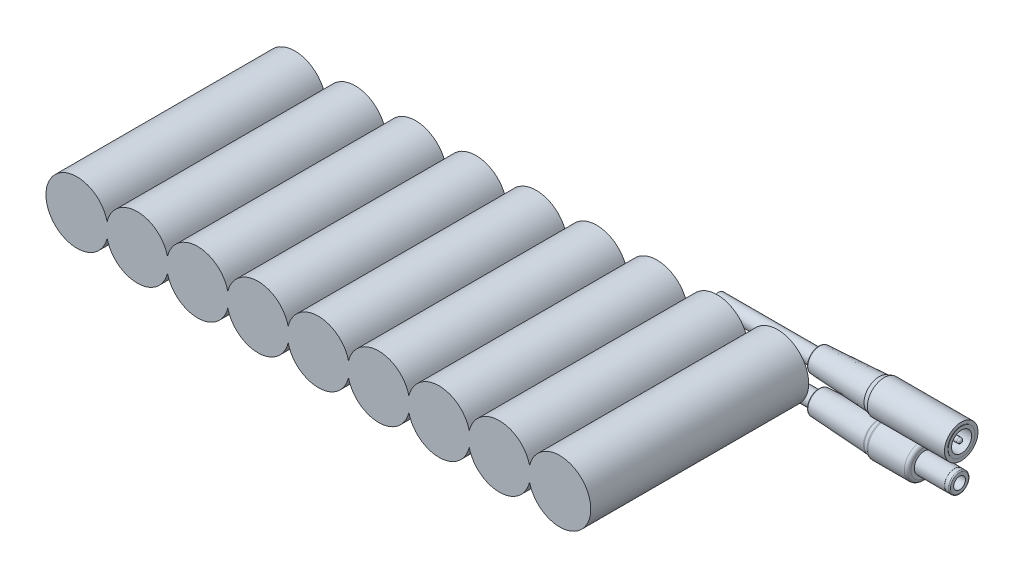
from build123d import *

# Parameters (mm, degrees)
SKETCH_1_R             = 9.25
EXTRUDE_1_DEPTH        = 65
PATTERN_LINEAR_1_COUNT = 9
PATTERN_LINEAR_1_PITCH = 18
SKETCH_4_R             = 2.25
EXTRUDE_2_DEPTH        = 30
EXTRUDE_2_2_DEPTH      = 30
SKETCH_9_R             = 3.5
SKETCH_10_R            = 4.5
SKETCH_11_R            = 5
SKETCH_14_R            = 4.5
SKETCH_12_R            = 5
SKETCH_13_R            = 4.5
SKETCH_17_R            = 5
EXTRUDE_3_DEPTH        = 23
SKETCH_18_R            = 5
EXTRUDE_4_DEPTH        = 12
SKETCH_19_R            = 3
EXTRUDE_5_DEPTH        = 9
SKETCH_20_R            = 2.98
EXTRUDE_6_DEPTH        = 1.5
SKETCH_21_R            = 4
EXTRUDE_7_DEPTH        = 0.1
SKETCH_22_R            = 3
SKETCH_22_R_2          = 0.75
CUT_EXTRUDE_1_DEPTH    = 10
FILLET_1_R             = 0.3
FILLET_2_R             = 0.7
FILLET_3_R             = 1
FILLET_4_R             = 1
FILLET_5_R             = 0.3
FILLET_6_R             = 0.3
SKETCH_23_R            = 1.75
CUT_EXTRUDE_2_DEPTH    = 5


with BuildPart() as part:
    # 草图1 → 凸台-拉伸1 (new body)
    with BuildSketch(Plane.XY):
        Circle(SKETCH_1_R)
    extrude_1 = extrude(amount=EXTRUDE_1_DEPTH)

    # 阵列(线性)1: 凸台-拉伸1 ×9
    with Locations(*[(-i * PATTERN_LINEAR_1_PITCH, 0, 0) for i in range(1, PATTERN_LINEAR_1_COUNT)]):
        add(extrude_1)


with BuildPart() as body_2:
    # 草图4 → 凸台-拉伸2 (new body)
    with BuildSketch(Plane(origin=(-20, 0, 0), x_dir=(0, 0, -1), z_dir=(1, 0, 0))):
        with Locations((2.25, -5.5)):
            Circle(SKETCH_4_R)
    extrude(amount=EXTRUDE_2_DEPTH)

    # 放样1: read off the stored shape, not the designer's step
    # 放样1: loft between two sections, ruled curve by curve
    loft_1_from = [
        Edge.make_bspline([(10, -6.265647347, 1.165228271), (10, -13.096103888, -0.366066424), (10, -11.564809194, -7.196522965), (10, -4.734352653, -5.665228271), (10, 2.096103888, -4.133933576), (10, 0.564809194, 2.696522965), (10, -6.265647347, 1.165228271)], [0, 0, 0, 0, 0.5, 0.5, 0.5, 1, 1, 1, 1], 3, [1, 0.333333333, 0.333333333, 1, 0.333333333, 0.333333333, 1]),
    ]
    loft_1_to = [
        Edge.make_bspline([(28, -7.36726301, 1.84430444), (28, -15.555871891, -1.89022158), (28, -11.821345871, -10.078830461), (28, -3.63273699, -6.34430444), (28, 4.555871891, -2.60977842), (28, 0.821345871, 5.578830461), (28, -7.36726301, 1.84430444)], [0, 0, 0, 0, 0.5, 0.5, 0.5, 1, 1, 1, 1], 3, [1, 0.333333333, 0.333333333, 1, 0.333333333, 0.333333333, 1]),
    ]
    loft_1 = Solid(Shell([*[Face.make_surface_from_curves(loft_1_from[k], loft_1_to[k]) for k in range(1)], Face(Wire(loft_1_from)), Face(Wire(loft_1_to))]))
    add(loft_1)

    # 草图11 → 放样3 section 0
    with BuildSketch(Plane(origin=(29.5, 0, 0), x_dir=(0, 0, -1), z_dir=(1, 0, 0))):
        with Locations((2.25, -5.5)):
            Circle(SKETCH_11_R)
    # 草图14 → 放样3 section 1
    with BuildSketch(Plane(origin=(28, 0, 0), x_dir=(0, 0, -1), z_dir=(1, 0, 0))):
        with Locations((2.25, -5.5)):
            Circle(SKETCH_14_R)
    loft()

    # 草图18 → 凸台-拉伸4 (add)
    with BuildSketch(Plane(origin=(29.5, 0, 0), x_dir=(0, 0, -1), z_dir=(1, 0, 0))):
        with Locations((2.25, -5.5)):
            Circle(SKETCH_18_R)
    extrude(amount=EXTRUDE_4_DEPTH)

    # 草图19 → 凸台-拉伸5 (add)
    with BuildSketch(Plane(origin=(41.5, 0, 0), x_dir=(0, 0, -1), z_dir=(1, 0, 0))):
        with Locations((2.25, -5.5)):
            Circle(SKETCH_19_R)
    extrude(amount=EXTRUDE_5_DEPTH)

    # 草图20 → 凸台-拉伸6 (add)
    with BuildSketch(Plane(origin=(50.5, 0, 0), x_dir=(0, 0, -1), z_dir=(1, 0, 0))):
        with Locations((2.25, -5.5)):
            Circle(SKETCH_20_R)
    extrude(amount=EXTRUDE_6_DEPTH)

    # 圆角1
    fillet_1_edges = [body_2.edges().sort_by_distance(p)[0] for p in [
        (52, -5.5, 0.73),
    ]]
    fillet(fillet_1_edges, radius=FILLET_1_R)

    # 圆角3
    fillet_3_edges = [body_2.edges().sort_by_distance(p)[0] for p in [
        (41.5, -5.5, 2.75),
    ]]
    fillet(fillet_3_edges, radius=FILLET_3_R)

    # 圆角4
    fillet_4_edges = [body_2.edges().sort_by_distance(p)[0] for p in [
        (29.5, -5.5, 2.75),
        (28, -1.102593379, -1.294586471),
        (28, -9.897406621, -3.205413528),
    ]]
    fillet(fillet_4_edges, radius=FILLET_4_R)

    # 圆角5
    fillet_5_edges = [body_2.edges().sort_by_distance(p)[0] for p in [
        (10, -5.5, 0),
        (10, -4.734352653, -5.665228271),
    ]]
    fillet(fillet_5_edges, radius=FILLET_5_R)

    # 草图23 → 切除-拉伸2 (cut)
    with BuildSketch(Plane(origin=(52, 0, 0), x_dir=(0, 0, -1), z_dir=(1, 0, 0))):
        with Locations((2.25, -5.5)):
            Circle(SKETCH_23_R)
    extrude(amount=-CUT_EXTRUDE_2_DEPTH, mode=Mode.SUBTRACT)


with BuildPart() as body_3:
    # 草图4 → Extrude 2 2 (new body)
    with BuildSketch(Plane(origin=(-20, 0, 0), x_dir=(0, 0, -1), z_dir=(1, 0, 0))):
        with Locations((2.25, 5.5)):
            Circle(SKETCH_4_R)
    extrude(amount=EXTRUDE_2_2_DEPTH)

    # 草图9 → 放样2 section 0
    with BuildSketch(Plane(origin=(10, 0, 0), x_dir=(0, 0, -1), z_dir=(1, 0, 0))):
        with Locations((2.25, 5.5)):
            Circle(SKETCH_9_R)
    # 草图10 → 放样2 section 1
    with BuildSketch(Plane(origin=(28, 0, 0), x_dir=(0, 0, -1), z_dir=(1, 0, 0))):
        with Locations((2.25, 5.5)):
            Circle(SKETCH_10_R)
    loft()

    # 草图12 → 放样4 section 0
    with BuildSketch(Plane(origin=(29.5, 0, 0), x_dir=(0, 0, -1), z_dir=(1, 0, 0))):
        with Locations((2.25, 5.5)):
            Circle(SKETCH_12_R)
    # 草图13 → 放样4 section 1
    with BuildSketch(Plane(origin=(28, 0, 0), x_dir=(0, 0, -1), z_dir=(1, 0, 0))):
        with Locations((2.25, 5.5)):
            Circle(SKETCH_13_R)
    loft()

    # 草图17 → 凸台-拉伸3 (add)
    with BuildSketch(Plane(origin=(29.5, 0, 0), x_dir=(0, 0, -1), z_dir=(1, 0, 0))):
        with Locations((2.25, 5.5)):
            Circle(SKETCH_17_R)
    extrude(amount=EXTRUDE_3_DEPTH)

    # 草图21 → 凸台-拉伸7 (add)
    with BuildSketch(Plane(origin=(52.5, 0, 0), x_dir=(0, 0, -1), z_dir=(1, 0, 0))):
        with Locations((2.25, 5.5)):
            Circle(SKETCH_21_R)
    extrude(amount=EXTRUDE_7_DEPTH)

    # 草图22 → 切除-拉伸1 (cut)
    with BuildSketch(Plane(origin=(52.6, 0, 0), x_dir=(0, 0, -1), z_dir=(1, 0, 0))):
        with Locations((2.25, 5.5)):
            Circle(SKETCH_22_R)
        with Locations((2.25, 5.5)):
            Circle(SKETCH_22_R_2, mode=Mode.SUBTRACT)
    extrude(amount=-CUT_EXTRUDE_1_DEPTH, mode=Mode.SUBTRACT)

    # 圆角2
    fillet_2_edges = [body_3.edges().sort_by_distance(p)[0] for p in [
        (52.6, 5.5, -1.5),
    ]]
    fillet(fillet_2_edges, radius=FILLET_2_R)

    # 圆角6
    fillet_6_edges = [body_3.edges().sort_by_distance(p)[0] for p in [
        (10, 5.5, 0),
        (10, 5.5, 1.25),
    ]]
    fillet(fillet_6_edges, radius=FILLET_6_R)


solid = Compound([part.part, body_2.part, body_3.part])
